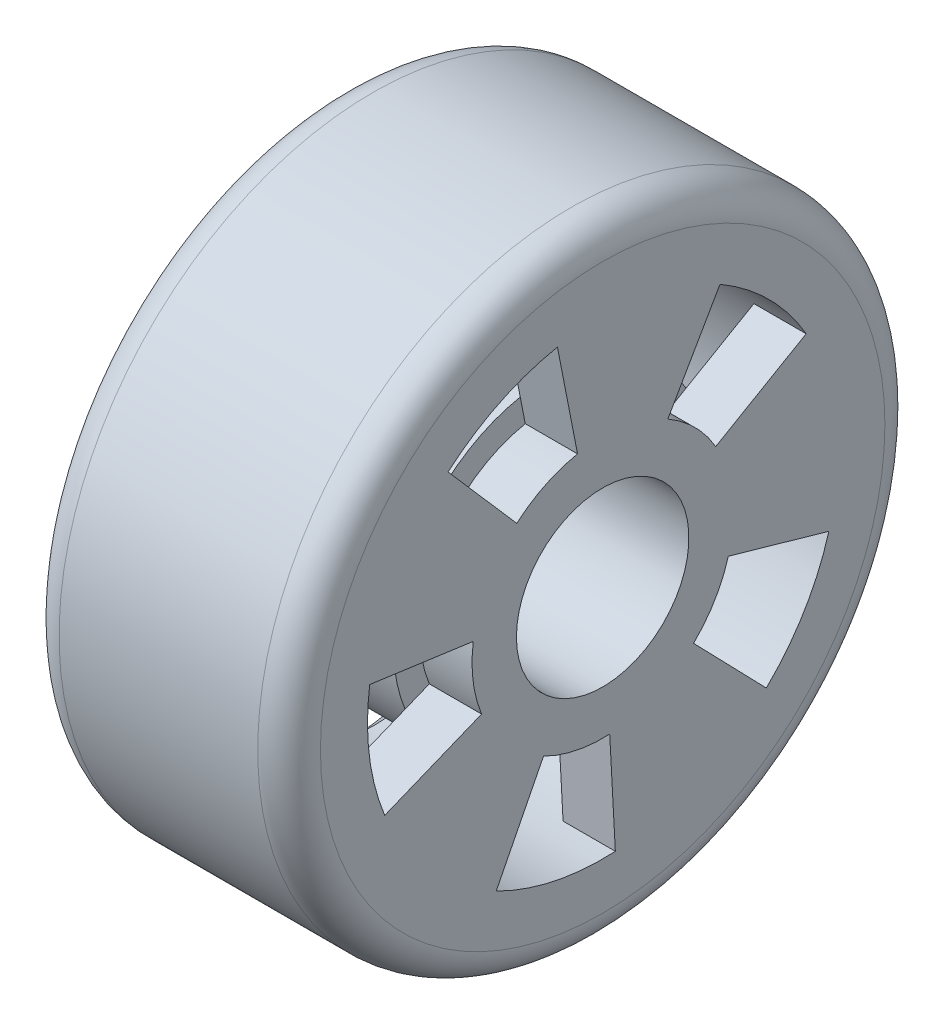
from build123d import *
from build123d.topology import SkipClean

# Parameters (mm, degrees)
SKETCH1_R           = 30
BOSS_EXTRUDE1_DEPTH = 25
FILLET1_R           = 3
SKETCH3_R           = 22.5
CUT_EXTRUDE1_DEPTH  = 20
CHAMFER1_SIZE       = 3
CUT_EXTRUDE2_DEPTH  = 50.244289131
CIRPATTERN1_COUNT   = 5
CIRPATTERN1_ANGLE   = 284
SKETCH4_R           = 15
BOSS_EXTRUDE2_DEPTH = 15
SKETCH5_R           = 8.25
CUT_EXTRUDE3_DEPTH  = 47.904157726
SKETCH6_R           = 10
SKETCH6_R_2         = 5
BOSS_EXTRUDE3_DEPTH = 3


with BuildPart() as part:
    # Sketch1 → Boss-Extrude1 (new body)
    with BuildSketch(Plane(origin=(0, 0, 0), x_dir=(0, 0, -1), z_dir=(1, 0, 0))):
        Circle(SKETCH1_R)
    extrude(amount=BOSS_EXTRUDE1_DEPTH)

    # Fillet1
    fillet1_edges = [part.edges().sort_by_distance(p)[0] for p in [
        (0, 0, 30),
        (25, 0, 30),
    ]]
    fillet(fillet1_edges, radius=FILLET1_R)

    # Sketch3 → Cut-Extrude1 (cut)
    with BuildSketch(Plane.ZY):
        Circle(SKETCH3_R)
    extrude(amount=-CUT_EXTRUDE1_DEPTH, mode=Mode.SUBTRACT)

    # Chamfer1
    chamfer1_edges = [part.edges().sort_by_distance(p)[0] for p in [
        (0, 0, -22.5),
    ]]
    chamfer(chamfer1_edges, length=CHAMFER1_SIZE)

    # Sketch2 → Cut-Extrude2 (cut, through all)
    with BuildSketch(Plane.ZY.offset(-25)):
        with BuildLine():
            Line((-6.233158363, 10.835023619), (-11.219685054, 19.503042514))
            ThreePointArc((-11.219685054, 19.503042514), (-15.885142396, 15.934624283), (-19.468053536, 11.280287741))
            Line((-19.468053536, 11.280287741), (-10.815585298, 6.266826523))
            ThreePointArc((-10.815585298, 6.266826523), (-8.825079109, 8.852569046), (-6.233158363, 10.835023619))
        make_face()
    cut_extrude2 = extrude(amount=CUT_EXTRUDE2_DEPTH, mode=Mode.SUBTRACT)

    # CirPattern1: Cut-Extrude2 ×5 about axis
    with SkipClean():  # the faces are left unmerged after this step: merging them gives an invalid solid
        cirpattern1_axis = Axis((25, 0, 0), (1, 0, 0))
        for i in range(1, CIRPATTERN1_COUNT):
            add(cut_extrude2.rotate(cirpattern1_axis, i * CIRPATTERN1_ANGLE / (CIRPATTERN1_COUNT - 1)), mode=Mode.SUBTRACT)
    add(part.part.scale(1), mode=Mode.REPLACE)  # the faces are merged on a copy

    # Sketch4 → Boss-Extrude2 (add)
    with BuildSketch(Plane.ZY.offset(-20)):
        Circle(SKETCH4_R)
    extrude(amount=BOSS_EXTRUDE2_DEPTH)

    # Sketch5 → Cut-Extrude3 (cut, through all)
    with BuildSketch(Plane.ZY.offset(-5)):
        Circle(SKETCH5_R)
    extrude(amount=-CUT_EXTRUDE3_DEPTH, mode=Mode.SUBTRACT)

    # Sketch6 → Boss-Extrude3 (add)
    with BuildSketch(Plane.ZY.offset(-5)):
        Circle(SKETCH6_R)
        Circle(SKETCH6_R_2, mode=Mode.SUBTRACT)
    extrude(amount=-BOSS_EXTRUDE3_DEPTH)


solid = part.part
